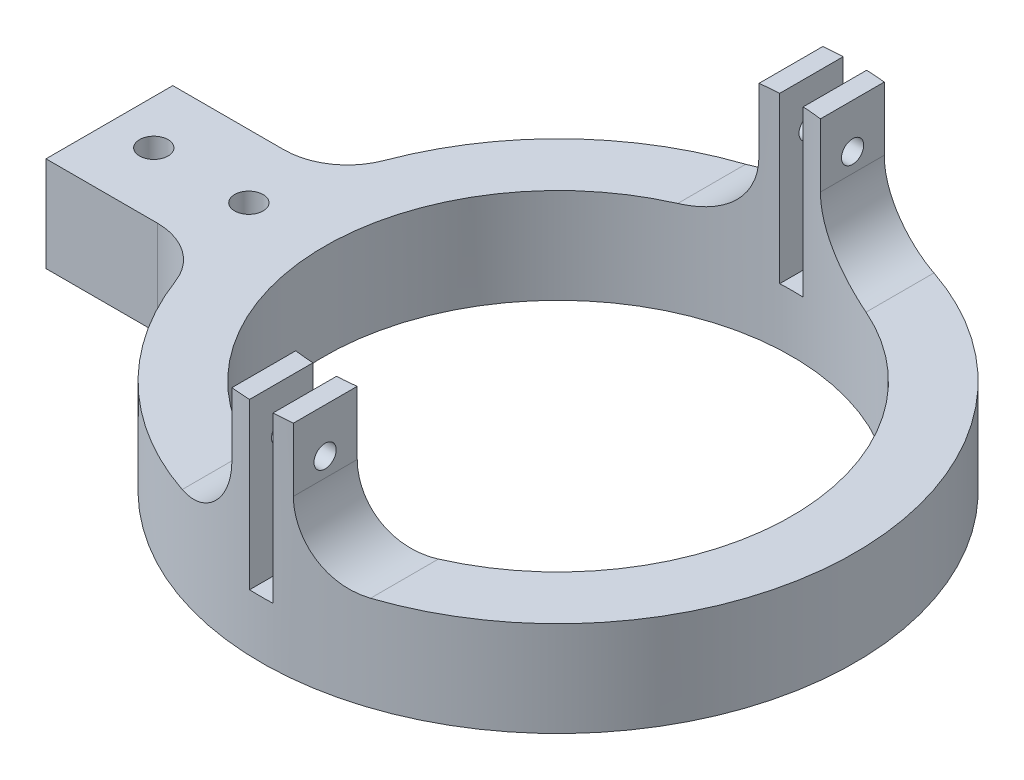
from build123d import *
from build123d.topology import SkipClean

# Parameters (mm, degrees)
SKETCH1_R           = 36.85
BOSS_EXTRUDE1_DEPTH = 15
SKETCH2_R           = 2.25
CUT_EXTRUDE1_DEPTH  = 87.187940965
BOSS_EXTRUDE2_DEPTH = 20
FILLET1_R           = 10
CUT_EXTRUDE2_START  = -6
CUT_EXTRUDE2_DEPTH  = 6
SKETCH5_R           = 1.75
CUT_EXTRUDE3_DEPTH  = 92.806106375
FILLET2_R           = 10


with BuildPart() as part:
    # Sketch1 → Boss-Extrude1 (new body)
    with BuildSketch(Plane(origin=(0, 0, 0), x_dir=(1, 0, 0), z_dir=(0, 1, 0))):
        with BuildLine():
            Line((-70.770323355, -10), (-45.770323355, -10))
            ThreePointArc((-45.770323355, -10), (46.85, 0), (-45.770323355, 10))
            Line((-45.770323355, 10), (-70.770323355, 10))
            Line((-70.770323355, 10), (-70.770323355, -10))
        make_face()
        with Locations(Location((0, 0, 0), (0, 0, 270))):
            Circle(SKETCH1_R, mode=Mode.SUBTRACT)
    extrude(amount=BOSS_EXTRUDE1_DEPTH)

    # Sketch2 → Cut-Extrude1 (cut, through all)
    with BuildSketch(Plane(origin=(0, 15, 0), x_dir=(1, 0, 0), z_dir=(0, 1, 0))):
        with Locations(Location((-63.770323355, 0, 0), (0, 0, 270))):
            Circle(SKETCH2_R)
        with Locations(Location((-48.770323355, 0, 0), (0, 0, 270))):
            Circle(SKETCH2_R)
    extrude(amount=-CUT_EXTRUDE1_DEPTH, mode=Mode.SUBTRACT)

    # Sketch3 → Boss-Extrude2 (add)
    with SkipClean():  # the faces are left unmerged after this step: merging them gives an invalid solid
        with BuildSketch(Plane(origin=(0, 15, 0), x_dir=(1, 0, 0), z_dir=(0, 1, 0))):
            with BuildLine():
                ThreePointArc((-1.85, -36.803532439), (-3.352802058, -36.697155453), (-4.85, -36.529440182))
                Line((-4.85, -36.529440182), (-4.85, -46.59828323))
                ThreePointArc((-4.85, -46.59828323), (-3.351727199, -46.729952116), (-1.85, -46.813459603))
                Line((-1.85, -46.813459603), (-1.85, -36.803532439))
            make_face()
            with BuildLine():
                ThreePointArc((1.85, -46.813459603), (3.351727199, -46.729952116), (4.85, -46.59828323))
                Line((4.85, -46.59828323), (4.85, -36.529440182))
                ThreePointArc((4.85, -36.529440182), (3.352802058, -36.697155453), (1.85, -36.803532439))
                Line((1.85, -36.803532439), (1.85, -46.813459603))
            make_face()
            with BuildLine():
                ThreePointArc((4.85, 46.59828323), (3.351727199, 46.729952116), (1.85, 46.813459603))
                Line((1.85, 46.813459603), (1.85, 36.803532439))
                ThreePointArc((1.85, 36.803532439), (3.352802058, 36.697155453), (4.85, 36.529440182))
                Line((4.85, 36.529440182), (4.85, 46.59828323))
            make_face()
            with BuildLine():
                Line((-1.85, 36.803532439), (-1.85, 46.813459603))
                ThreePointArc((-1.85, 46.813459603), (-3.351727199, 46.729952116), (-4.85, 46.59828323))
                Line((-4.85, 46.59828323), (-4.85, 36.529440182))
                ThreePointArc((-4.85, 36.529440182), (-3.352802058, 36.697155453), (-1.85, 36.803532439))
            make_face()
        extrude(amount=BOSS_EXTRUDE2_DEPTH)

    # Fillet1
    # the kernel refuses this fillet: 10 mm, written as the material it adds along each edge
    with BuildSketch(Plane(origin=(-4.85, 15, 11.529440182), x_dir=(-1, 0, 0), z_dir=(0, 0, 1))) as fillet1_piece_1_section:
        with BuildLine():
            CenterArc((FILLET1_R, -FILLET1_R), FILLET1_R, 90, 90)
            Line((0, -FILLET1_R), (0, 0))
            Line((0, 0), (FILLET1_R, 0))
        make_face()
    fillet1_piece_1 = extrude(amount=60.068843048, mode=Mode.PRIVATE)
    fillet1_piece_1 = fillet1_piece_1 & Plane(origin=(0, 17.250913244, 0), x_dir=(-0.9769546073589704, 0, 0.2134471718249741), z_dir=(0, -1, 0)) * Cylinder(46.85, 161, mode=Mode.PRIVATE)
    fillet1_piece_1 = fillet1_piece_1 - Plane(origin=(0, 17.250913244, 0), x_dir=(0, 0, 1), z_dir=(0, -1, 0)) * Cylinder(36.85, 161, mode=Mode.PRIVATE)
    with BuildSketch(Plane(origin=(4.85, 15, 71.59828323), x_dir=(1, 0, 0), z_dir=(0, 0, -1))) as fillet1_piece_2_section:
        with BuildLine():
            CenterArc((FILLET1_R, -FILLET1_R), FILLET1_R, 90, 90)
            Line((0, -FILLET1_R), (0, 0))
            Line((0, 0), (FILLET1_R, 0))
        make_face()
    fillet1_piece_2 = extrude(amount=60.068843048, mode=Mode.PRIVATE)
    fillet1_piece_2 = fillet1_piece_2 & Plane(origin=(0, 17.250905791, 0), x_dir=(-0.9769546073589704, 0, 0.2134471718249741), z_dir=(0, -1, 0)) * Cylinder(46.85, 161, mode=Mode.PRIVATE)
    fillet1_piece_2 = fillet1_piece_2 - Plane(origin=(0, 17.250905791, 0), x_dir=(0, 0, 1), z_dir=(0, -1, 0)) * Cylinder(36.85, 161, mode=Mode.PRIVATE)
    with BuildSketch(Plane(origin=(4.85, 15, -11.529440182), x_dir=(1, 0, 0), z_dir=(0, 0, -1))) as fillet1_piece_3_section:
        with BuildLine():
            CenterArc((FILLET1_R, -FILLET1_R), FILLET1_R, 90, 90)
            Line((0, -FILLET1_R), (0, 0))
            Line((0, 0), (FILLET1_R, 0))
        make_face()
    fillet1_piece_3 = extrude(amount=60.068843048, mode=Mode.PRIVATE)
    fillet1_piece_3 = fillet1_piece_3 & Plane(origin=(0, 17.250913244, 0), x_dir=(-0.9769546073589704, 0, 0.2134471718249741), z_dir=(0, -1, 0)) * Cylinder(46.85, 161, mode=Mode.PRIVATE)
    fillet1_piece_3 = fillet1_piece_3 - Plane(origin=(0, 17.250913244, 0), x_dir=(0, 0, 1), z_dir=(0, -1, 0)) * Cylinder(36.85, 161, mode=Mode.PRIVATE)
    with BuildSketch(Plane(origin=(-4.85, 15, -71.59828323), x_dir=(-1, 0, 0), z_dir=(0, 0, 1))) as fillet1_piece_4_section:
        with BuildLine():
            CenterArc((FILLET1_R, -FILLET1_R), FILLET1_R, 90, 90)
            Line((0, -FILLET1_R), (0, 0))
            Line((0, 0), (FILLET1_R, 0))
        make_face()
    fillet1_piece_4 = extrude(amount=60.068843048, mode=Mode.PRIVATE)
    fillet1_piece_4 = fillet1_piece_4 & Plane(origin=(0, 17.250905791, 0), x_dir=(-0.9769546073589704, 0, 0.2134471718249741), z_dir=(0, -1, 0)) * Cylinder(46.85, 161, mode=Mode.PRIVATE)
    fillet1_piece_4 = fillet1_piece_4 - Plane(origin=(0, 17.250905791, 0), x_dir=(0, 0, 1), z_dir=(0, -1, 0)) * Cylinder(36.85, 161, mode=Mode.PRIVATE)
    add([fillet1_piece_1, fillet1_piece_2, fillet1_piece_3, fillet1_piece_4])

    # Sketch4 → Cut-Extrude2 (cut)
    with BuildSketch(Plane(origin=(0, 15, 0), x_dir=(1, 0, 0), z_dir=(0, 1, 0)).offset(CUT_EXTRUDE2_START)):
        with BuildLine():
            Line((-1.85, 46.813459603), (-1.85, 36.803532439))
            ThreePointArc((-1.85, 36.803532439), (0, 36.85), (1.85, 36.803532439))
            Line((1.85, 36.803532439), (1.85, 46.813459603))
            ThreePointArc((1.85, 46.813459603), (0, 46.85), (-1.85, 46.813459603))
        make_face()
        with BuildLine():
            Line((1.85, -46.813459603), (1.85, -36.803532439))
            ThreePointArc((1.85, -36.803532439), (0, -36.85), (-1.85, -36.803532439))
            Line((-1.85, -36.803532439), (-1.85, -46.813459603))
            ThreePointArc((-1.85, -46.813459603), (0, -46.85), (1.85, -46.813459603))
        make_face()
    extrude(amount=CUT_EXTRUDE2_DEPTH, mode=Mode.SUBTRACT)

    # Sketch5 → Cut-Extrude3 (cut, symmetric)
    with BuildSketch(Plane(origin=(0, 0, 0), x_dir=(0, 0, -1), z_dir=(1, 0, 0))):
        with Locations(Location((-41.6, 28, 0), (0, 0, 180))):
            Circle(SKETCH5_R)
    cut_extrude3 = extrude(amount=CUT_EXTRUDE3_DEPTH, both=True, mode=Mode.SUBTRACT)

    # Fillet2
    fillet2_edges = [part.edges().sort_by_distance(p)[0] for p in [
        (-45.770323355, 7.5, 10),
        (-45.770323355, 7.5, -10),
    ]]
    fillet(fillet2_edges, radius=FILLET2_R)

    # Mirror1: Cut-Extrude3 across plane
    add(cut_extrude3.mirror(Plane.XY), mode=Mode.SUBTRACT)


solid = part.part
